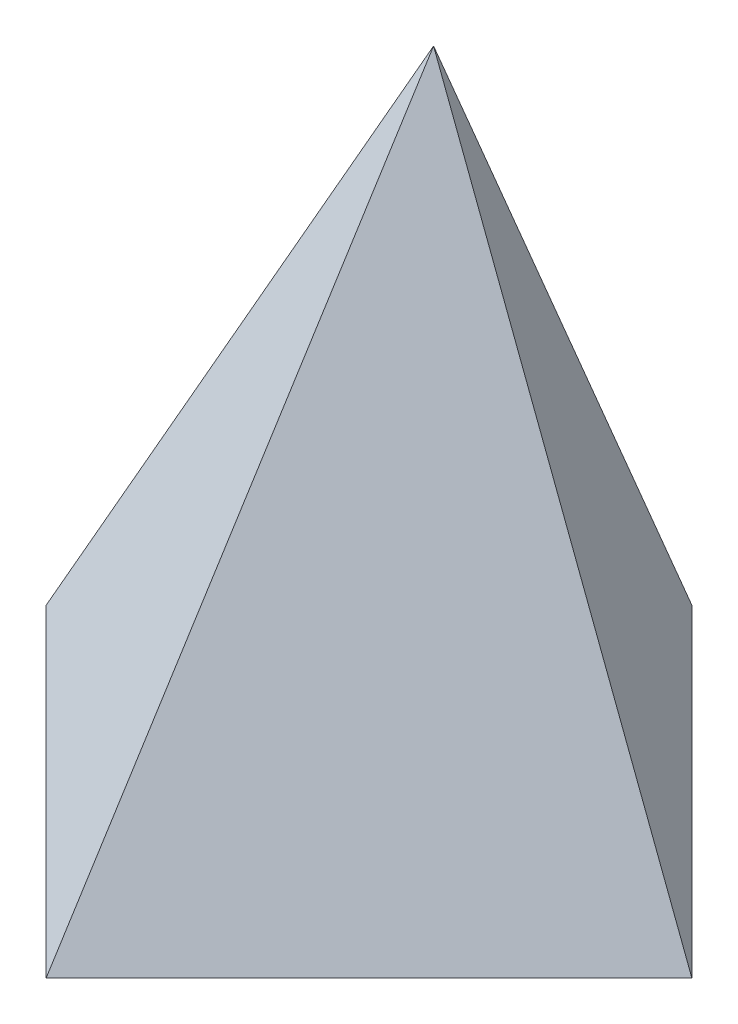
from build123d import *

# Parameters (mm, degrees)
EXTRUDE_1_DEPTH = 200


# Read off the part's stored shape, not the designer's step: 本體-刪除/保留 2, 本體-刪除/保留 3, 本體-刪除/保留 4
with BuildPart() as part:
    # 草圖1 → 填料-伸長1 (new body)
    with BuildSketch(Plane(origin=(0, 0, 0), x_dir=(1, 0, 0), z_dir=(0, 1, 0))):
        Polygon((0, 100), (-100, 0), (0, -100), (100, 0), align=None)
    extrude(amount=EXTRUDE_1_DEPTH)


with BuildPart() as body_2:
    # Split Bodies 2: the piece on the far side of the plane
    add(part.part)
    split(bisect_by=Plane(origin=(-44.444444444, 22.222222222, -44.444444444), x_dir=(0.7071067811865474, 0, -0.7071067811865479), z_dir=(-0.666666666666667, 0.33333333333333337, -0.6666666666666665)), keep=Keep.BOTTOM)


with BuildPart() as part_1:
    add(part.part)

    # Split Bodies 2
    split(bisect_by=Plane(origin=(-44.444444444, 22.222222222, -44.444444444), x_dir=(0.7071067811865474, 0, -0.7071067811865479), z_dir=(-0.666666666666667, 0.33333333333333337, -0.6666666666666665)), keep=Keep.TOP)


with BuildPart() as body_2_2:
    # Split Bodies 3: the piece on the far side of the plane
    add(body_2.part)
    split(bisect_by=Plane(origin=(-42.372881356, 25.423728814, 42.372881356), x_dir=(0.7071067811865476, 0, 0.7071067811865476), z_dir=(-0.6509445549041194, 0.39056673294247174, 0.6509445549041194)), keep=Keep.BOTTOM)


with BuildPart() as body_2_1:
    add(body_2.part)

    # Split Bodies 3
    split(bisect_by=Plane(origin=(-42.372881356, 25.423728814, 42.372881356), x_dir=(0.7071067811865476, 0, 0.7071067811865476), z_dir=(-0.6509445549041194, 0.39056673294247174, 0.6509445549041194)), keep=Keep.TOP)


with BuildPart() as body_2_3:
    # Split Bodies 4: the piece on the far side of the plane
    add(body_2_2.part)
    split(bisect_by=Plane(origin=(44.444444444, 22.222222222, 44.444444444), x_dir=(0.7071067811865479, 0, -0.7071067811865474), z_dir=(0.6666666666666665, 0.33333333333333337, 0.666666666666667)), keep=Keep.BOTTOM)


with BuildPart() as body_2_2_1:
    add(body_2_2.part)

    # Split Bodies 4
    split(bisect_by=Plane(origin=(44.444444444, 22.222222222, 44.444444444), x_dir=(0.7071067811865479, 0, -0.7071067811865474), z_dir=(0.6666666666666665, 0.33333333333333337, 0.666666666666667)), keep=Keep.TOP)


with BuildPart() as body_2_4:
    # Split Bodies 5: the piece on the far side of the plane
    add(body_2_3.part)
    split(bisect_by=Plane(origin=(46.296296296, 18.518518519, -46.296296296), x_dir=(-0.7071067811865475, 0, -0.7071067811865477), z_dir=(-0.6804138174397718, -0.2721655269759089, 0.6804138174397716)), keep=Keep.BOTTOM)


with BuildPart() as body_2_3_1:
    add(body_2_3.part)

    # Split Bodies 5
    split(bisect_by=Plane(origin=(46.296296296, 18.518518519, -46.296296296), x_dir=(-0.7071067811865475, 0, -0.7071067811865477), z_dir=(-0.6804138174397718, -0.2721655269759089, 0.6804138174397716)), keep=Keep.TOP)


solid = body_2_3_1.part
